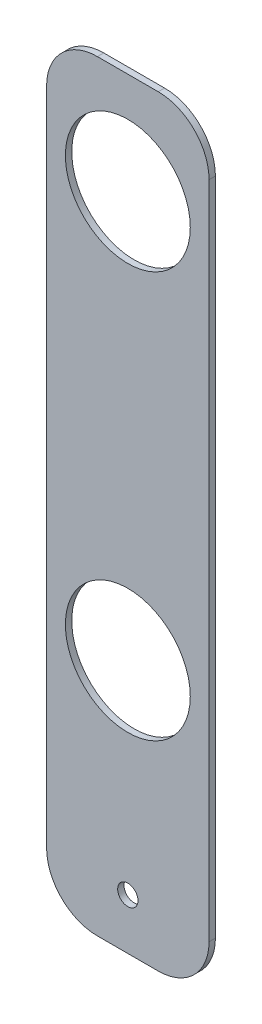
from build123d import *

# Parameters (mm, degrees)
SKETCH1_R           = 15.621
SKETCH1_R_2         = 2.54
BOSS_EXTRUDE1_DEPTH = 1.5875


with BuildPart() as part:
    # Sketch1 → Boss-Extrude1 (new body)
    with BuildSketch(Plane.XY):
        with BuildLine():
            Line((-7.62, 25.4), (7.62, 25.4))
            ThreePointArc((7.62, 25.4), (16.600256121, 21.680256121), (20.32, 12.7))
            Line((20.32, 12.7), (20.32, -152.4))
            ThreePointArc((20.32, -152.4), (16.600256121, -161.380256121), (7.62, -165.1))
            Line((7.62, -165.1), (-7.62, -165.1))
            ThreePointArc((-7.62, -165.1), (-16.600256121, -161.380256121), (-20.32, -152.4))
            Line((-20.32, -152.4), (-20.32, 12.7))
            ThreePointArc((-20.32, 12.7), (-16.600256121, 21.680256121), (-7.62, 25.4))
        make_face()
        Circle(SKETCH1_R, mode=Mode.SUBTRACT)
        with Locations((0, -101.6)):
            Circle(SKETCH1_R, mode=Mode.SUBTRACT)
        with Locations((0, -152.4)):
            Circle(SKETCH1_R_2, mode=Mode.SUBTRACT)
    extrude(amount=BOSS_EXTRUDE1_DEPTH)


solid = part.part
